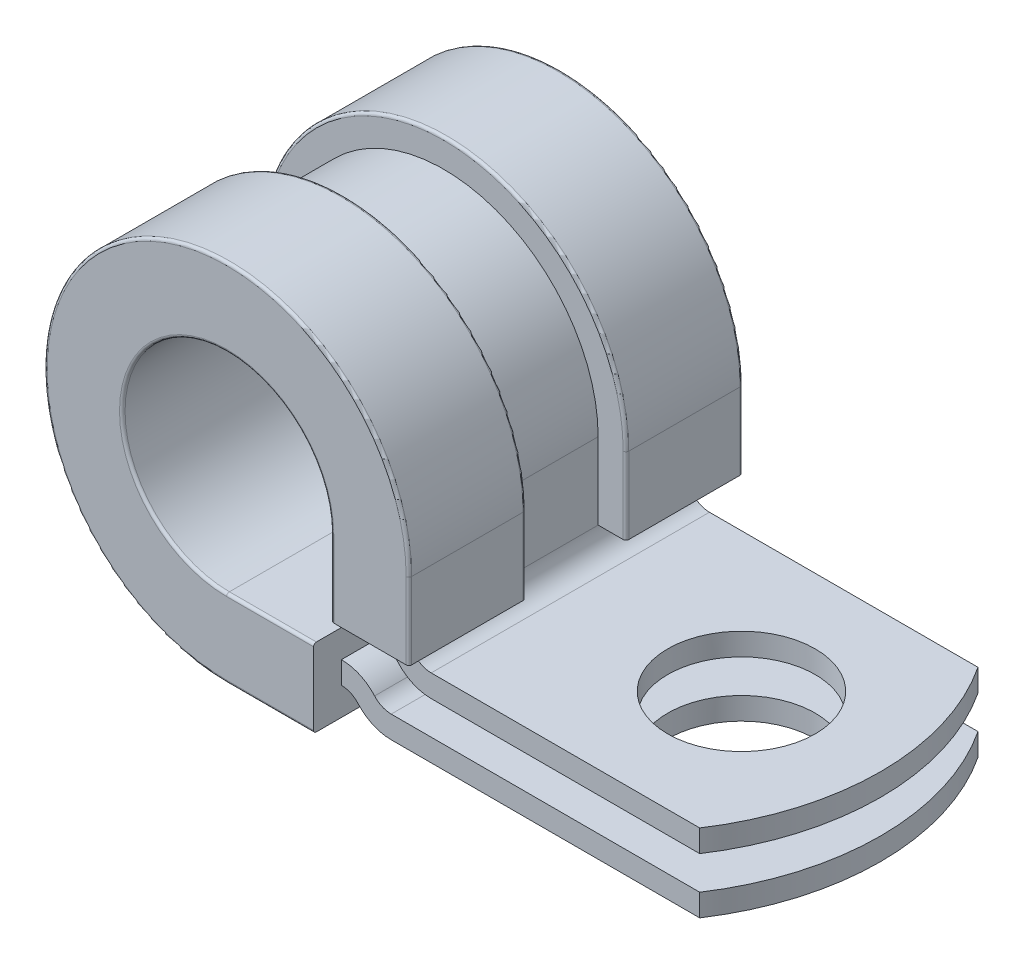
from build123d import *

# Parameters (mm, degrees)
BOSS_EXTRUDE1_DEPTH         = 6.35
SKETCH26_R                  = 3.3655
CUT_EXTRUDE1_DEPTH          = 25.480794212
CUT_EXTRUDE3_DEPTH          = 25.480794212
CUT_EXTRUDE3_DEPTH_BACK     = 25.480794212
BOSS_EXTRUDE2_DEPTH         = 7.62
BOSS_EXTRUDE2_DEPTH_BACK    = 7.62
BODY_MOVE_COPY1_START       = -8.0645
BODY_MOVE_COPY1_OUTLINE_R   = 3.3655
BODY_MOVE_COPY1_DEPTH       = 1.016
BODY_MOVE_COPY1_START_2     = -3.4925
BODY_MOVE_COPY1_2_OUTLINE_W = 1.016
BODY_MOVE_COPY1_2_OUTLINE_H = 12.7
BODY_MOVE_COPY1_2_DEPTH     = 3.4925
BODY_MOVE_COPY1_START_3     = -7.387166667
BODY_MOVE_COPY1_3_OUTLINE_W = 1.016
BODY_MOVE_COPY1_3_OUTLINE_H = 12.7
BODY_MOVE_COPY1_3_DEPTH     = 0.338666667
BODY_MOVE_COPY1_START_4     = -5.5245
BODY_MOVE_COPY1_4_OUTLINE_R = 3.3655
BODY_MOVE_COPY1_4_DEPTH     = 2.032
BODY_MOVE_COPY1_5_OUTLINE_W = 1.016
BODY_MOVE_COPY1_5_OUTLINE_H = 12.7
BODY_MOVE_COPY1_5_DEPTH     = 6.0325
BODY_MOVE_COPY1_6_OUTLINE_W = 1.016
BODY_MOVE_COPY1_6_OUTLINE_H = 12.7
BODY_MOVE_COPY1_6_DEPTH     = 1.354666667
BODY_MOVE_COPY1_START_5     = -6.35
BODY_MOVE_COPY1_7_DEPTH     = 12.7
BODY_MOVE_COPY1_8_DEPTH     = 12.7
CUT_EXTRUDE4_DEPTH          = 2.286
CUT_EXTRUDE4_DEPTH_BACK     = 2.286
FILLET1_R                   = 0.127


with BuildPart() as part:
    # Sketch25 → Boss-Extrude1 (new, symmetric)
    with BuildSketch(Plane.XY):
        with BuildLine():
            Line((0, -6.0325), (3.96875, -6.0325))
            ThreePointArc((3.96875, -6.0325), (4.798310526, -6.209546272), (5.483313377, -6.709833333))
            ThreePointArc((5.483313377, -6.709833333), (5.825814802, -6.959976864), (6.240595065, -7.0485))
            Line((6.240595065, -7.0485), (22.225, -7.0485))
            Line((22.225, -7.0485), (22.225, -8.0645))
            Line((22.225, -8.0645), (6.240595065, -8.0645))
            ThreePointArc((6.240595065, -8.0645), (5.411034539, -7.887453728), (4.726031688, -7.387166667))
            ThreePointArc((4.726031688, -7.387166667), (4.383530263, -7.137023136), (3.96875, -7.0485))
            Line((3.96875, -7.0485), (0, -7.0485))
            ThreePointArc((0, -7.0485), (-4.984042147, 4.984042147), (7.0485, 0))
            Line((7.0485, 0), (7.0485, -3.4925))
            ThreePointArc((7.0485, -3.4925), (7.34607951, -4.21092049), (8.0645, -4.5085))
            Line((8.0645, -4.5085), (22.225, -4.5085))
            Line((22.225, -4.5085), (22.225, -5.5245))
            Line((22.225, -5.5245), (8.0645, -5.5245))
            ThreePointArc((8.0645, -5.5245), (6.627659021, -4.929340979), (6.0325, -3.4925))
            Line((6.0325, -3.4925), (6.0325, 0))
            ThreePointArc((6.0325, 0), (-4.265621658, 4.265621658), (0, -6.0325))
        make_face()
    extrude(amount=BOSS_EXTRUDE1_DEPTH, both=True)

    # Sketch26 → Cut-Extrude1 (cut, through all)
    with BuildSketch(Plane(origin=(0, 0, 0), x_dir=(1, 0, 0), z_dir=(0, 1, 0))):
        with Locations(Location((15.875, 0, 0), (0, 0, 270))):
            Circle(SKETCH26_R)
    extrude(amount=-CUT_EXTRUDE1_DEPTH, mode=Mode.SUBTRACT)

    # Sketch4 → Cut-Extrude3 (cut, two sides: drawn at the far end of the back side and taken through both)
    with BuildSketch(Plane(origin=(0, 0, 0), x_dir=(1, 0, 0), z_dir=(0, 1, 0)).offset(-CUT_EXTRUDE3_DEPTH_BACK)):
        with BuildLine():
            Line((-18.401015586, 65.076873638), (20.32, 6.35))
            ThreePointArc((20.32, 6.35), (22.225, 0), (20.32, -6.35))
            Line((20.32, -6.35), (-18.401015586, -65.076873638))
            Line((-18.401015586, -65.076873638), (122.285341042, -65.076873638))
            Line((122.285341042, -65.076873638), (122.285341042, 65.076873638))
            Line((122.285341042, 65.076873638), (-18.401015586, 65.076873638))
        make_face()
    extrude(amount=CUT_EXTRUDE3_DEPTH + CUT_EXTRUDE3_DEPTH_BACK, mode=Mode.SUBTRACT)


with BuildPart() as body_2:
    # Sketch5 → Boss-Extrude2 (new, two sides: drawn at the far end of the back side and taken through both)
    with BuildSketch(Plane.XY.offset(-BOSS_EXTRUDE2_DEPTH_BACK)):
        with BuildLine():
            Line((4.7625, 0), (4.7625, -3.4925))
            Line((4.7625, -3.4925), (8.3185, -3.4925))
            Line((8.3185, -3.4925), (8.3185, 0))
            ThreePointArc((8.3185, 0), (-5.882067759, 5.882067759), (0, -8.3185))
            Line((0, -8.3185), (3.96875, -8.3185))
            Line((3.96875, -8.3185), (3.96875, -4.7625))
            Line((3.96875, -4.7625), (0, -4.7625))
            ThreePointArc((0, -4.7625), (-3.367596045, 3.367596045), (4.7625, 0))
        make_face()
    extrude(amount=BOSS_EXTRUDE2_DEPTH + BOSS_EXTRUDE2_DEPTH_BACK)


with BuildPart() as body_3:
    # Body-Move/Copy1: read off the stored shape, not the designer's step
    # Body-Move/Copy1 outline → Body-Move/Copy1 (new body)
    with BuildSketch(Plane(origin=(0, 0, 0), x_dir=(1, 0, 0), z_dir=(0, 1, 0)).offset(BODY_MOVE_COPY1_START)):
        with BuildLine():
            Line((7.0485, -6.35), (20.32, -6.35))
            ThreePointArc((20.32, -6.35), (22.225, 0), (20.32, 6.35))
            Line((20.32, 6.35), (7.0485, 6.35))
            Line((7.0485, 6.35), (7.0485, -6.35))
        make_face()
        with Locations((15.875, 0)):
            Circle(BODY_MOVE_COPY1_OUTLINE_R, mode=Mode.SUBTRACT)
    extrude(amount=BODY_MOVE_COPY1_DEPTH)

    # Body-Move_Copy1 2 outline → Body-Move_Copy1 2 (add)
    with BuildSketch(Plane(origin=(0, 0, 0), x_dir=(1, 0, 0), z_dir=(0, 1, 0)).offset(BODY_MOVE_COPY1_START_2)):
        with Locations((6.5405, 0)):
            Rectangle(BODY_MOVE_COPY1_2_OUTLINE_W, BODY_MOVE_COPY1_2_OUTLINE_H)
    extrude(amount=BODY_MOVE_COPY1_2_DEPTH)

    # Body-Move_Copy1 3 outline → Body-Move_Copy1 3 (add)
    with BuildSketch(Plane(origin=(0, 0, 0), x_dir=(1, 0, 0), z_dir=(0, 1, 0)).offset(BODY_MOVE_COPY1_START_3)):
        with Locations((6.5405, 0)):
            Rectangle(BODY_MOVE_COPY1_3_OUTLINE_W, BODY_MOVE_COPY1_3_OUTLINE_H)
    extrude(amount=BODY_MOVE_COPY1_3_DEPTH)

    # Body-Move_Copy1 4 outline → Body-Move_Copy1 4 (add)
    with BuildSketch(Plane(origin=(0, 0, 0), x_dir=(1, 0, 0), z_dir=(0, 1, 0)).offset(BODY_MOVE_COPY1_START_4)):
        with BuildLine():
            ThreePointArc((20.32, -6.35), (22.225, 0), (20.32, 6.35))
            Line((20.32, 6.35), (6.0325, 6.35))
            Line((6.0325, 6.35), (6.0325, -6.35))
            Line((6.0325, -6.35), (20.32, -6.35))
        make_face()
        with Locations((15.875, 0)):
            Circle(BODY_MOVE_COPY1_4_OUTLINE_R, mode=Mode.SUBTRACT)
    extrude(amount=BODY_MOVE_COPY1_4_DEPTH)

    # Body-Move_Copy1 5 outline → Body-Move_Copy1 5 (add)
    with BuildSketch(Plane(origin=(0, 0, 0), x_dir=(1, 0, 0), z_dir=(0, 1, 0))):
        with Locations((6.5405, 0)):
            Rectangle(BODY_MOVE_COPY1_5_OUTLINE_W, BODY_MOVE_COPY1_5_OUTLINE_H)
    extrude(amount=BODY_MOVE_COPY1_5_DEPTH)

    # Body-Move_Copy1 6 outline → Body-Move_Copy1 6 (add)
    with BuildSketch(Plane(origin=(0, 0, 0), x_dir=(1, 0, 0), z_dir=(0, 1, 0)).offset(BODY_MOVE_COPY1_START)):
        with Locations((6.5405, 0)):
            Rectangle(BODY_MOVE_COPY1_6_OUTLINE_W, BODY_MOVE_COPY1_6_OUTLINE_H)
    extrude(amount=BODY_MOVE_COPY1_6_DEPTH)

    # Body-Move_Copy1 7 outline → Body-Move_Copy1 7 (cut)
    with BuildSketch(Plane.XY.offset(BODY_MOVE_COPY1_START_5)):
        with BuildLine():
            ThreePointArc((7.0485, -3.4925), (7.34607951, -4.21092049), (8.0645, -4.5085))
            Line((8.0645, -4.5085), (24, -4.5085))
            Line((24, -4.5085), (24, -3.4925))
            Line((24, -3.4925), (7.0485, -3.4925))
        make_face()
        with BuildLine():
            ThreePointArc((6.032499998, 3.645585828), (6.789750676, 1.892257384), (7.0485, 0))
            Line((7.0485, 0), (7.0485, 6.0325))
            Line((7.0485, 6.0325), (6.0325, 6.0325))
            Line((6.0325, 6.0325), (6.032499998, 3.645585828))
        make_face()
        with BuildLine():
            Line((6.0325, -5.5245), (8.0645, -5.5245))
            ThreePointArc((8.0645, -5.5245), (6.627659021, -4.929340979), (6.0325, -3.4925))
            Line((6.0325, -3.4925), (6.0325, -5.5245))
        make_face()
        with BuildLine():
            Line((7.0485, -7.0485), (7.0485, -6.709833333))
            Line((7.0485, -6.709833333), (6.0325, -6.709833333))
            Line((6.0325, -6.709833333), (6.0325, -7.026960881))
            ThreePointArc((6.0325, -7.026960881), (6.13599166, -7.043100875), (6.240595065, -7.0485))
            Line((6.240595065, -7.0485), (7.0485, -7.0485))
        make_face()
        with BuildLine():
            Line((7.0485, -10), (7.0485, -8.064500001))
            Line((7.0485, -8.064500001), (6.240595065, -8.0645))
            ThreePointArc((6.240595065, -8.0645), (6.136410502, -8.06182737), (6.0325, -8.053816512))
            Line((6.0325, -8.053816512), (6.0325, -10))
            Line((6.0325, -10), (7.0485, -10))
        make_face()
    extrude(amount=BODY_MOVE_COPY1_7_DEPTH, mode=Mode.SUBTRACT)

    # Body-Move_Copy1 8 outline → Body-Move_Copy1 8 (add)
    with BuildSketch(Plane.XY.offset(BODY_MOVE_COPY1_START_5)):
        with BuildLine():
            Line((6.0325, 0), (6.032499998, 3.645585828))
            ThreePointArc((6.032499998, 3.645585828), (-6.139106773, 3.463050717), (0, -7.0485))
            Line((0, -7.0485), (3.96875, -7.0485))
            ThreePointArc((3.96875, -7.0485), (4.383530263, -7.137023136), (4.726031688, -7.387166667))
            ThreePointArc((4.726031688, -7.387166667), (5.317018576, -7.842480792), (6.0325, -8.053816512))
            Line((6.0325, -8.053816512), (6.0325, -7.026960881))
            ThreePointArc((6.0325, -7.026960881), (5.732529578, -6.912343998), (5.483313377, -6.709833333))
            ThreePointArc((5.483313377, -6.709833333), (4.798310526, -6.209546272), (3.96875, -6.0325))
            Line((3.96875, -6.0325), (0, -6.0325))
            ThreePointArc((0, -6.0325), (-4.265621658, 4.265621658), (6.0325, 0))
        make_face()
    extrude(amount=BODY_MOVE_COPY1_8_DEPTH)


with BuildPart() as body_2_1:
    add(body_2.part)

    # Combine1: cut body 3
    add(body_3.part, mode=Mode.SUBTRACT)

    # Sketch7 → Cut-Extrude4 (cut, two sides: drawn at the far end of the back side and taken through both)
    with BuildSketch(Plane.XY.offset(-CUT_EXTRUDE4_DEPTH_BACK)):
        with BuildLine():
            Line((6.0325, 0), (6.0325, -3.4925))
            Line((6.0325, -3.4925), (8.3185, -3.4925))
            Line((8.3185, -3.4925), (8.3185, 0))
            ThreePointArc((8.3185, 0), (-5.882067759, 5.882067759), (0, -8.3185))
            Line((0, -8.3185), (3.96875, -8.3185))
            Line((3.96875, -8.3185), (3.96875, -6.0325))
            Line((3.96875, -6.0325), (0, -6.0325))
            ThreePointArc((0, -6.0325), (-4.265621658, 4.265621658), (6.0325, 0))
        make_face()
    extrude(amount=CUT_EXTRUDE4_DEPTH + CUT_EXTRUDE4_DEPTH_BACK, mode=Mode.SUBTRACT)

    # Fillet1
    fillet1_edges = [body_2_1.edges().sort_by_distance(p)[0] for p in [
        (1.984375, -8.3185, 2.286),
        (1.984375, -8.3185, -2.286),
        (-5.882067759, 5.882067759, 2.286),
        (-5.882067759, 5.882067759, -2.286),
        (8.3185, -1.74625, 2.286),
        (8.3185, -1.74625, -2.286),
        (1.984375, -4.7625, 7.62),
        (1.984375, -8.3185, 7.62),
        (-5.882067759, 5.882067759, 7.62),
        (8.3185, -1.74625, 7.62),
        (4.7625, -1.74625, 7.62),
        (-3.367596045, 3.367596045, 7.62),
        (4.7625, -1.74625, -7.62),
        (8.3185, -1.74625, -7.62),
        (-5.882067759, 5.882067759, -7.62),
        (1.984375, -8.3185, -7.62),
        (1.984375, -4.7625, -7.62),
        (-3.367596045, 3.367596045, -7.62),
    ]]
    fillet(fillet1_edges, radius=FILLET1_R)


solid = Compound([part.part, body_2_1.part])
